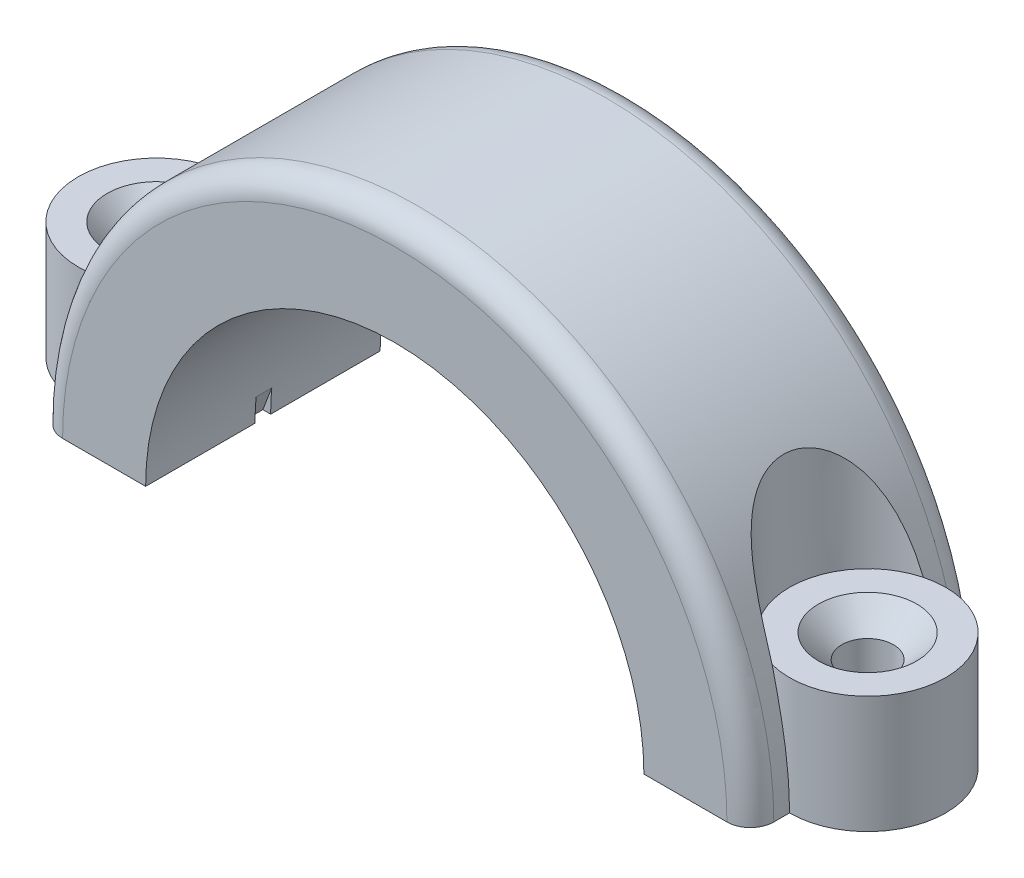
from build123d import *

# Parameters (mm, degrees)
BOSS_EXTRUDE1_DEPTH                             = 15
SKETCH2_R                                       = 10
BOSS_EXTRUDE2_DEPTH                             = 15
CUT_EXTRUDE1_START                              = -15
SKETCH2_2_R                                     = 10
CUT_EXTRUDE1_DEPTH                              = 45
CUT_EXTRUDE1_DRAFT                              = 3
CSK_FOR_M6_FLAT_HEAD_MACHINE_SCREW1_D           = 6.6
CSK_FOR_M6_FLAT_HEAD_MACHINE_SCREW1_CSINK_D     = 12.6
CSK_FOR_M6_FLAT_HEAD_MACHINE_SCREW1_CSINK_ANGLE = 90
MIRROR1_START                                   = -15
MIRROR1_COPY_1_SKETCH_R                         = 10
MIRROR1_COPY_1_DEPTH                            = 45
MIRROR1_COPY_1_DRAFT                            = 3
FILLET1_R                                       = 3
SKETCH5_W                                       = 1
SKETCH5_H                                       = 2


with BuildPart() as part:
    # Sketch1 → Boss-Extrude1 (new, symmetric)
    with BuildSketch(Plane.XY):
        with BuildLine():
            Line((-45.5, 0), (-31.875, 0))
            ThreePointArc((-31.875, 0), (0, 31.875), (31.875, 0))
            Line((31.875, 0), (45.5, 0))
            ThreePointArc((45.5, 0), (0, 45.5), (-45.5, 0))
        make_face()
    extrude(amount=BOSS_EXTRUDE1_DEPTH, both=True)

    # Sketch2 → Boss-Extrude2 (add)
    with BuildSketch(Plane.XZ):
        with Locations((-45.5, 0)):
            Circle(SKETCH2_R)
    boss_extrude2 = extrude(amount=-BOSS_EXTRUDE2_DEPTH)


with BuildPart() as cut_extrude1_tool:
    # Sketch2<2> → Cut-Extrude1 (with draft: the straight prism first)
    with BuildSketch(Plane.XZ.offset(CUT_EXTRUDE1_START)):
        with Locations((-45.5, 0)):
            Circle(SKETCH2_2_R)
    extrude(amount=-CUT_EXTRUDE1_DEPTH)
    # Cut-Extrude1: the draft: its side faces are tilted about the plane it starts from
    cut_extrude1_sides = [cut_extrude1_tool.faces().sort_by_distance(p)[0] for p in [
        (-55.5, 37.5, 0),
    ]]
    draft(cut_extrude1_sides, Plane.XZ.offset(CUT_EXTRUDE1_START), CUT_EXTRUDE1_DRAFT)


with BuildPart() as part_1:
    add(part.part)

    # Cut-Extrude1: cut by cut_extrude1_tool
    add(cut_extrude1_tool.part, mode=Mode.SUBTRACT)

    # CSK for M6 Flat Head Machine Screw1 (through all)
    with Locations(Plane(origin=(0, 15, 0), x_dir=(1, 0, 0), z_dir=(0, 1, 0))):
        with Locations((-45.5, 0)):
            csk_for_m6_flat_head_machine_screw1 = CounterSinkHole(CSK_FOR_M6_FLAT_HEAD_MACHINE_SCREW1_D / 2, CSK_FOR_M6_FLAT_HEAD_MACHINE_SCREW1_CSINK_D / 2, counter_sink_angle=CSK_FOR_M6_FLAT_HEAD_MACHINE_SCREW1_CSINK_ANGLE)

    # Mirror1: Boss-Extrude2, CSK for M6 Flat Head Machine Screw1 across plane
    add(boss_extrude2.mirror(Plane(origin=(0, 0, 0), x_dir=(0, 0, 1), z_dir=(1, 0, 0))))
    add(csk_for_m6_flat_head_machine_screw1.mirror(Plane(origin=(0, 0, 0), x_dir=(0, 0, 1), z_dir=(1, 0, 0))), mode=Mode.SUBTRACT)


with BuildPart() as mirror1_copy_1_tool:
    # Mirror1 copy 1 sketch → Mirror1 copy 1 (with draft: the straight prism first)
    with BuildSketch(Plane(origin=(0, 0, 0), x_dir=(-1, 0, 0), z_dir=(0, -1, 0)).offset(MIRROR1_START)):
        with Locations((-45.5, 0)):
            Circle(MIRROR1_COPY_1_SKETCH_R)
    extrude(amount=-MIRROR1_COPY_1_DEPTH)
    # Mirror1 copy 1: the draft: its side faces are tilted about the plane it starts from
    mirror1_copy_1_sides = [mirror1_copy_1_tool.faces().sort_by_distance(p)[0] for p in [
        (55.5, 37.5, 0),
    ]]
    draft(mirror1_copy_1_sides, Plane(origin=(0, 0, 0), x_dir=(-1, 0, 0), z_dir=(0, -1, 0)).offset(MIRROR1_START), MIRROR1_COPY_1_DRAFT)


with BuildPart() as part_2:
    add(part_1.part)

    # Mirror1 copy 1: cut by mirror1_copy_1_tool
    add(mirror1_copy_1_tool.part, mode=Mode.SUBTRACT)

    # Fillet1
    fillet1_edges = [part_2.edges().sort_by_distance(p)[0] for p in [
        (0, 45.5, 15),
        (0, 45.5, -15),
    ]]
    fillet(fillet1_edges, radius=FILLET1_R)

    # Cut-Sweep1: sweep along a path in Sketch6
    with BuildLine(Plane.XY) as cut_sweep1_path:
        Line((-32.875, 0), (-31.733509497, 3))
    # Sketch5 → Cut-Sweep1 (sweep, cut)
    with BuildSketch(Plane(origin=(0, 0, 10), x_dir=(1, 0, 0), z_dir=(0, 1, 0))):
        with Locations((-32.375, 10)):
            Rectangle(SKETCH5_W, SKETCH5_H)
    sweep(path=cut_sweep1_path.line, mode=Mode.SUBTRACT)


solid = part_2.part
